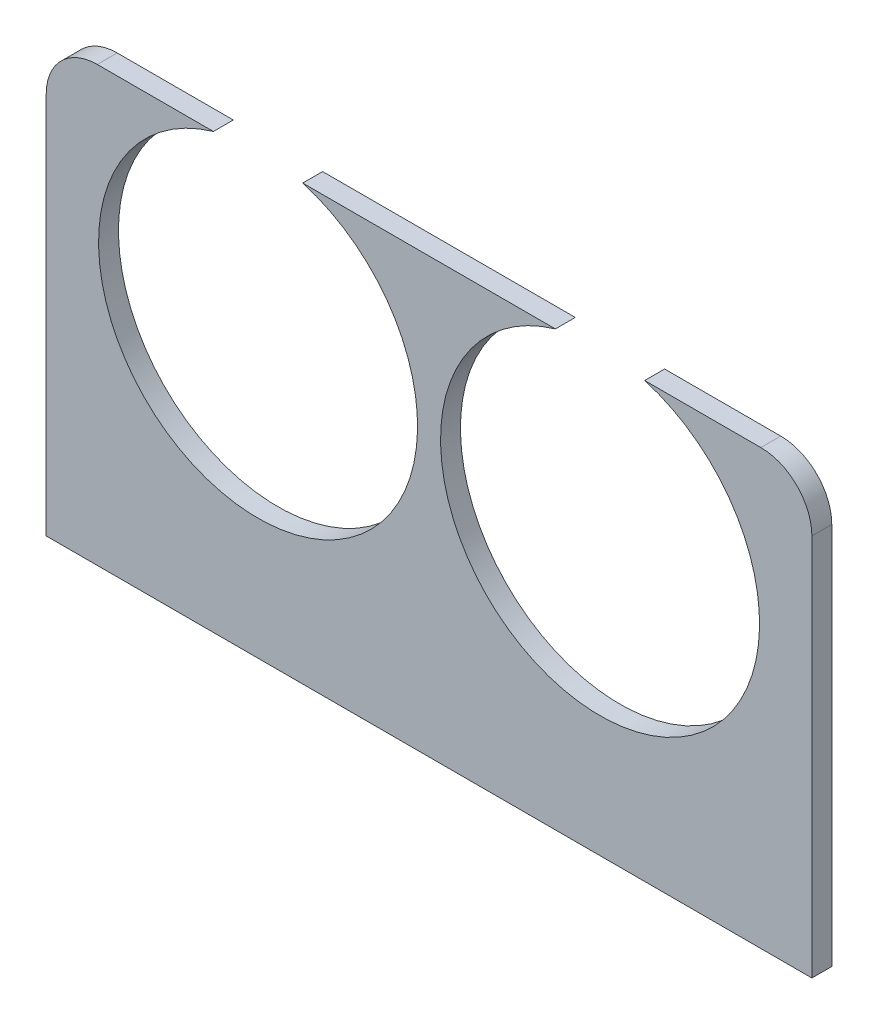
from build123d import *

# Parameters (mm, degrees)
BOSS_EXTRUDE1_DEPTH = 0.78
FILLET1_R           = 2


with BuildPart() as part:
    # Sketch1 → Boss-Extrude1 (new body)
    with BuildSketch(Plane.XY):
        with BuildLine():
            Line((-15, 8.5), (-15, -8.5))
            Line((-15, -8.5), (15, -8.5))
            Line((15, -8.5), (15, 8.5))
            Line((15, 8.5), (8.45, 8.5))
            ThreePointArc((8.45, 8.5), (11.7, 6.25), (12.95, 2.5))
            ThreePointArc((12.95, 2.5), (2.95, -2.5), (4.95, 8.5))
            Line((4.95, 8.5), (-4.95, 8.5))
            ThreePointArc((-4.95, 8.5), (-1.7, 6.25), (-0.45, 2.5))
            ThreePointArc((-0.45, 2.5), (-10.45, -2.5), (-8.45, 8.5))
            Line((-8.45, 8.5), (-15, 8.5))
        make_face()
    extrude(amount=BOSS_EXTRUDE1_DEPTH)

    # Fillet1
    fillet1_edges = [part.edges().sort_by_distance(p)[0] for p in [
        (15, 8.5, 0.39),
        (-15, 8.5, 0.39),
    ]]
    fillet(fillet1_edges, radius=FILLET1_R)


solid = part.part
